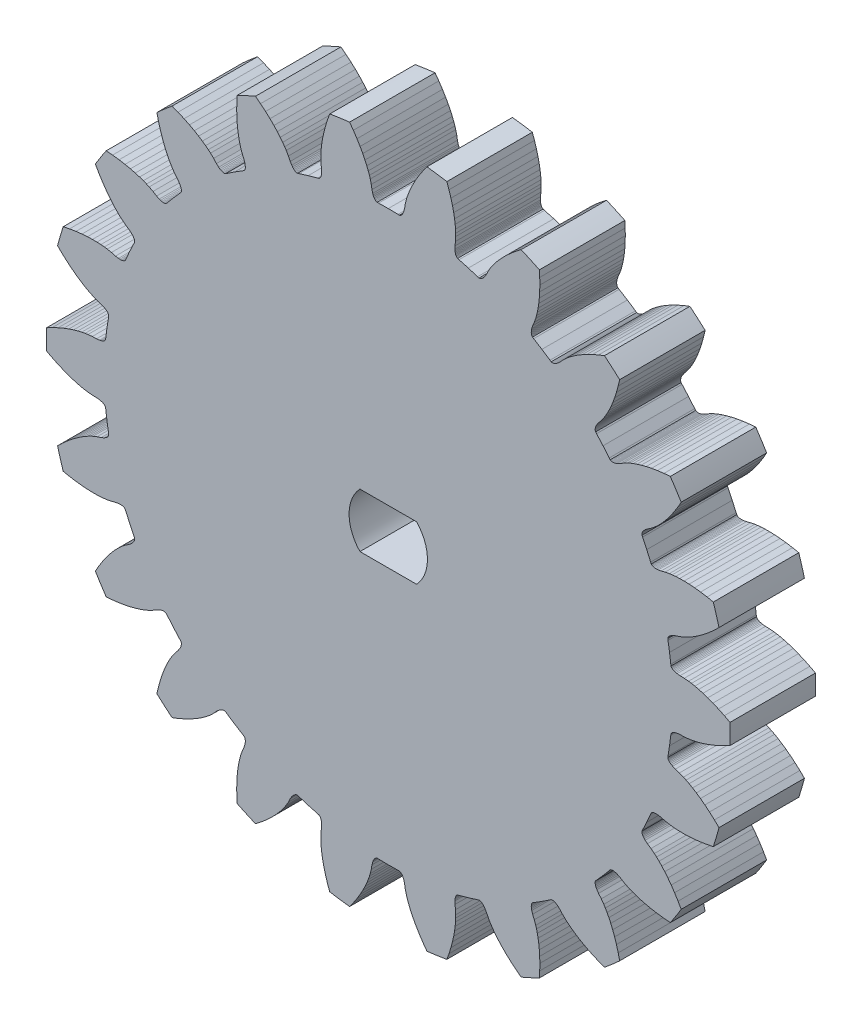
from build123d import *

# Parameters (mm, degrees)
BOSS_EXTRUDE1_DEPTH = 6


with BuildPart() as part:
    # Model → Boss-Extrude1 (new body)
    with BuildSketch(Plane.XY):
        with BuildLine():
            Line((22.5519537, 5.4619929), (22.8954461, 5.7695777))
            Line((22.8954461, 5.7695777), (23.216661298, 6.081558392))
            ThreePointArc((23.216661298, 6.081558392), (23.027805404, 6.761573866), (22.81903653, 7.435742355))
            Line((22.81903653, 7.435742355), (22.3801441, 7.5245351))
            Line((22.3801441, 7.5245351), (21.924887, 7.5975859))
            Line((21.924887, 7.5975859), (21.5060561, 7.646915))
            Line((21.5060561, 7.646915), (21.1197237, 7.6761155))
            Line((21.1197237, 7.6761155), (20.7695422, 7.6878778))
            Line((20.7695422, 7.6878778), (20.4552721, 7.6853026))
            Line((20.4552721, 7.6853026), (20.1767714, 7.6713482))
            Line((20.1767714, 7.6713482), (19.9347995, 7.6490219))
            Line((19.9347995, 7.6490219), (19.73335, 7.6219283))
            Line((19.73335, 7.6219283), (19.4360948, 7.5636803))
            Line((19.4360948, 7.5636803), (19.1488665, 7.4859797))
            Line((19.1488665, 7.4859797), (18.9443781, 7.4508803))
            Line((18.9443781, 7.4508803), (18.8538346, 7.4443357))
            Line((18.8538346, 7.4443357), (18.7714324, 7.4446863))
            Line((18.7714324, 7.4446863), (18.697414, 7.45157))
            Line((18.697414, 7.45157), (18.6320181, 7.4646561))
            Line((18.6320181, 7.4646561), (18.575464, 7.4835611))
            Line((18.575464, 7.4835611), (18.5279675, 7.5079327))
            Line((18.5279675, 7.5079327), (18.4897345, 7.5373924))
            Line((18.4897345, 7.5373924), (18.4609353, 7.5715671))
            Line((18.4609353, 7.5715671), (18.4188308, 7.6649666))
            Line((18.4188308, 7.6649666), (18.1471583, 8.2875295))
            Line((18.1471583, 8.2875295), (17.8545643, 8.9005379))
            Line((17.8545643, 8.9005379), (17.8115502, 8.993522))
            Line((17.8115502, 8.993522), (17.8045822, 9.0376666))
            Line((17.8045822, 9.0376666), (17.8073554, 9.0858532))
            Line((17.8073554, 9.0858532), (17.8200401, 9.1377087))
            Line((17.8200401, 9.1377087), (17.8427877, 9.1928296))
            Line((17.8427877, 9.1928296), (17.8757231, 9.2508221))
            Line((17.8757231, 9.2508221), (17.9189925, 9.3112693))
            Line((17.9189925, 9.3112693), (17.9726895, 9.3737743))
            Line((17.9726895, 9.3737743), (18.036929, 9.4379168))
            Line((18.036929, 9.4379168), (18.1973667, 9.5694736))
            Line((18.1973667, 9.5694736), (18.4441834, 9.7356631))
            Line((18.4441834, 9.7356631), (18.6828652, 9.9221693))
            Line((18.6828652, 9.9221693), (18.8352625, 10.0566722))
            Line((18.8352625, 10.0566722), (19.0105934, 10.2249217))
            Line((19.0105934, 10.2249217), (19.2035186, 10.4262603))
            Line((19.2035186, 10.4262603), (19.4112681, 10.6620834))
            Line((19.4112681, 10.6620834), (19.6316988, 10.9344355))
            Line((19.6316988, 10.9344355), (19.8626244, 11.2455283))
            Line((19.8626244, 11.2455283), (20.0996199, 11.5943634))
            Line((20.0996199, 11.5943634), (20.3425418, 11.9862618))
            Line((20.3425418, 11.9862618), (20.5628503, 12.3761017))
            ThreePointArc((20.5628503, 12.3761017), (20.190062091, 12.975365035), (19.7998148, 13.5634081))
            Line((19.7998148, 13.5634081), (19.3536845, 13.5249538))
            Line((19.3536845, 13.5249538), (18.8962878, 13.4667848))
            Line((18.8962878, 13.4667848), (18.4805248, 13.3961174))
            Line((18.4805248, 13.3961174), (18.1016148, 13.3152927))
            Line((18.1016148, 13.3152927), (17.7623043, 13.227921))
            Line((17.7623043, 13.227921), (17.4614899, 13.1369099))
            Line((17.4614899, 13.1369099), (17.1982018, 13.0450581))
            Line((17.1982018, 13.0450581), (16.9723216, 12.9554648))
            Line((16.9723216, 12.9554648), (16.7866653, 12.8727138))
            Line((16.7866653, 12.8727138), (16.5178614, 12.7330787))
            Line((16.5178614, 12.7330787), (16.2641587, 12.577604))
            Line((16.2641587, 12.577604), (16.0778422, 12.4863154))
            Line((16.0778422, 12.4863154), (15.9928101, 12.4545268))
            Line((15.9928101, 12.4545268), (15.913647, 12.4316478))
            Line((15.913647, 12.4316478), (15.8406875, 12.4173993))
            Line((15.8406875, 12.4173993), (15.7742538, 12.4115312))
            Line((15.7742538, 12.4115312), (15.7146644, 12.4137373))
            Line((15.7146644, 12.4137373), (15.6622255, 12.4237404))
            Line((15.6622255, 12.4237404), (15.6172415, 12.4412352))
            Line((15.6172415, 12.4412352), (15.5799807, 12.4659119))
            Line((15.5799807, 12.4659119), (15.5132681, 12.5436659))
            Line((15.5132681, 12.5436659), (15.077204, 13.0644716))
            Line((15.077204, 13.0644716), (14.6237577, 13.5702156))
            Line((14.6237577, 13.5702156), (14.5562893, 13.6473147))
            Line((14.5562893, 13.6473147), (14.5371666, 13.6877081))
            Line((14.5371666, 13.6877081), (14.5262517, 13.734724))
            Line((14.5262517, 13.734724), (14.5238132, 13.7880527))
            Line((14.5238132, 13.7880527), (14.5301101, 13.8473496))
            Line((14.5301101, 13.8473496), (14.5453729, 13.9122719))
            Line((14.5453729, 13.9122719), (14.5698597, 13.9824611))
            Line((14.5698597, 13.9824611), (14.6037719, 14.0575624))
            Line((14.6037719, 14.0575624), (14.6473382, 14.137205))
            Line((14.6473382, 14.137205), (14.7642133, 14.3086333))
            Line((14.7642133, 14.3086333), (14.9542111, 14.5376273))
            Line((14.9542111, 14.5376273), (15.1306797, 14.7838231))
            Line((15.1306797, 14.7838231), (15.23901, 14.955813))
            Line((15.23901, 14.955813), (15.3598375, 15.1666436))
            Line((15.3598375, 15.1666436), (15.4882242, 15.4141799))
            Line((15.4882242, 15.4141799), (15.6211193, 15.6989803))
            Line((15.6211193, 15.6989803), (15.7558906, 16.0224027))
            Line((15.7558906, 16.0224027), (15.8898171, 16.3859534))
            Line((15.8898171, 16.3859534), (16.0189345, 16.7874275))
            Line((16.0189345, 16.7874275), (16.1416057, 17.2318903))
            Line((16.1416057, 17.2318903), (16.243159651, 17.668007218))
            ThreePointArc((16.243159651, 17.668007218), (15.716639844, 18.137969452), (15.176529291, 18.592247119))
            Line((15.176529291, 18.592247119), (14.7593045, 18.4296611))
            Line((14.7593045, 18.4296611), (14.3368236, 18.2449848))
            Line((14.3368236, 18.2449848), (13.9578113, 18.060046))
            Line((13.9578113, 18.060046), (13.6170208, 17.875744))
            Line((13.6170208, 17.875744), (13.3160702, 17.6963167))
            Line((13.3160702, 17.6963167), (13.0530816, 17.5242429))
            Line((13.0530816, 17.5242429), (12.8263363, 17.3619349))
            Line((12.8263363, 17.3619349), (12.6348471, 17.212333))
            Line((12.6348471, 17.212333), (12.4800249, 17.0806286))
            Line((12.4800249, 17.0806286), (12.2614491, 16.8709189))
            Line((12.2614491, 16.8709189), (12.0618254, 16.6502657))
            Line((12.0618254, 16.6502657), (11.908775, 16.5101834))
            Line((11.908775, 16.5101834), (11.8361432, 16.4557263))
            Line((11.8361432, 16.4557263), (11.7666326, 16.4114712))
            Line((11.7666326, 16.4114712), (11.7006427, 16.3772447))
            Line((11.7006427, 16.3772447), (11.6385533, 16.3528978))
            Line((11.6385533, 16.3528978), (11.5807561, 16.3382262))
            Line((11.5807561, 16.3382262), (11.5276232, 16.3330504))
            Line((11.5276232, 16.3330504), (11.4795324, 16.3371631))
            Line((11.4795324, 16.3371631), (11.4368288, 16.3503427))
            Line((11.4368288, 16.3503427), (11.3509127, 16.4061519))
            Line((11.3509127, 16.4061519), (10.7857843, 16.783008))
            Line((10.7857843, 16.783008), (10.2082212, 17.1405152))
            Line((10.2082212, 17.1405152), (10.1217644, 17.1954832))
            Line((10.1217644, 17.1954832), (10.0920362, 17.2288528))
            Line((10.0920362, 17.2288528), (10.0683175, 17.2708892))
            Line((10.0683175, 17.2708892), (10.0509534, 17.3213708))
            Line((10.0509534, 17.3213708), (10.0402893, 17.3800397))
            Line((10.0402893, 17.3800397), (10.0366432, 17.4466323))
            Line((10.0366432, 17.4466323), (10.0403635, 17.520877))
            Line((10.0403635, 17.520877), (10.0517435, 17.6024903))
            Line((10.0517435, 17.6024903), (10.0711072, 17.6911809))
            Line((10.0711072, 17.6911809), (10.134951, 17.8885927))
            Line((10.134951, 17.8885927), (10.2527376, 18.1618394))
            Line((10.2527376, 18.1618394), (10.3526966, 18.4477795))
            Line((10.3526966, 18.4477795), (10.4081836, 18.6433227))
            Line((10.4081836, 18.6433227), (10.4647189, 18.8796543))
            Line((10.4647189, 18.8796543), (10.518166, 19.1533343))
            Line((10.518166, 19.1533343), (10.5654404, 19.4640391))
            Line((10.5654404, 19.4640391), (10.6036338, 19.8123302))
            Line((10.6036338, 19.8123302), (10.6297113, 20.198886))
            Line((10.6297113, 20.198886), (10.6404902, 20.6204741))
            Line((10.6404902, 20.6204741), (10.6329728, 21.0814935))
            Line((10.6329728, 21.0814935), (10.6075447, 21.5285554))
            ThreePointArc((10.6075447, 21.5285554), (9.969949089, 21.831143292), (9.3237321, 22.114853))
            Line((9.3237321, 22.114853), (8.9692134, 21.841307))
            Line((8.9692134, 21.841307), (8.6158753, 21.5450847))
            Line((8.6158753, 21.5450847), (8.3043189, 21.2608571))
            Line((8.3043189, 21.2608571), (8.0292567, 20.9880088))
            Line((8.0292567, 20.9880088), (7.7910473, 20.731062))
            Line((7.7910473, 20.731062), (7.5871903, 20.491866))
            Line((7.5871903, 20.491866), (7.4153572, 20.2722511))
            Line((7.4153572, 20.2722511), (7.2737725, 20.0747603))
            Line((7.2737725, 20.0747603), (7.162327, 19.9047724))
            Line((7.162327, 19.9047724), (7.0116872, 19.6419776))
            Line((7.0116872, 19.6419776), (6.8823148, 19.3740219))
            Line((6.8823148, 19.3740219), (6.7749298, 19.1964946))
            Line((6.7749298, 19.1964946), (6.7205824, 19.1237806))
            Line((6.7205824, 19.1237806), (6.6663555, 19.0617348))
            Line((6.6663555, 19.0617348), (6.6126814, 19.0103032))
            Line((6.6126814, 19.0103032), (6.5599664, 18.9694499))
            Line((6.5599664, 18.9694499), (6.5086439, 18.9390893))
            Line((6.5086439, 18.9390893), (6.4591214, 18.9191539))
            Line((6.4591214, 18.9191539), (6.41182, 18.9095513))
            Line((6.41182, 18.9095513), (6.367133, 18.9101659))
            Line((6.367133, 18.9101659), (6.2689738, 18.9395092))
            Line((6.2689738, 18.9395092), (5.6205645, 19.1418848))
            Line((5.6205645, 19.1418848), (4.9656753, 19.3221921))
            Line((4.9656753, 19.3221921), (4.8672344, 19.3505759))
            Line((4.8672344, 19.3505759), (4.829309, 19.3742184))
            Line((4.829309, 19.3742184), (4.7947081, 19.4078697))
            Line((4.7947081, 19.4078697), (4.7638251, 19.4514143))
            Line((4.7638251, 19.4514143), (4.737064, 19.5047023))
            Line((4.737064, 19.5047023), (4.7148043, 19.5675702))
            Line((4.7148043, 19.5675702), (4.6974568, 19.6398556))
            Line((4.6974568, 19.6398556), (4.6853827, 19.7213692))
            Line((4.6853827, 19.7213692), (4.6789749, 19.8119225))
            Line((4.6789749, 19.8119225), (4.6846154, 20.0193246))
            Line((4.6846154, 20.0193246), (4.7206482, 20.3146873))
            Line((4.7206482, 20.3146873), (4.7359996, 20.6172065))
            Line((4.7359996, 20.6172065), (4.7341481, 20.8204613))
            Line((4.7341481, 20.8204613), (4.721811, 21.0631476))
            Line((4.721811, 21.0631476), (4.6959885, 21.3407995))
            Line((4.6959885, 21.3407995), (4.6538123, 21.6522373))
            Line((4.6538123, 21.6522373), (4.5923337, 21.9971805))
            Line((4.5923337, 21.9971805), (4.5084496, 22.3754249))
            Line((4.5084496, 22.3754249), (4.4000167, 22.7829725))
            Line((4.4000167, 22.7829725), (4.2629196, 23.2231995))
            Line((4.2629196, 23.2231995), (4.112569617, 23.644988633))
            ThreePointArc((4.112569617, 23.644988633), (3.415552159, 23.755687923), (2.715581155, 23.8458448))
            Line((2.715581155, 23.8458448), (2.45249, 23.4835))
            Line((2.45249, 23.4835), (2.19692, 23.09973))
            Line((2.19692, 23.09973), (1.97806, 22.73924))
            Line((1.97806, 22.73924), (1.79101, 22.39995))
            Line((1.79101, 22.39995), (1.63484, 22.0863))
            Line((1.63484, 22.0863), (1.50663, 21.79936))
            Line((1.50663, 21.79936), (1.40363, 21.54023))
            Line((1.40363, 21.54023), (1.32342, 21.31085))
            Line((1.32342, 21.31085), (1.26438, 21.11635))
            Line((1.26438, 21.11635), (1.19388, 20.82176))
            Line((1.19388, 20.82176), (1.14524, 20.52821))
            Line((1.14524, 20.52821), (1.09222, 20.32762))
            Line((1.09222, 20.32762), (1.06056, 20.24254))
            Line((1.06056, 20.24254), (1.02601, 20.16773))
            Line((1.02601, 20.16773), (0.989, 20.10326))
            Line((0.989, 20.10326), (0.94993, 20.04921))
            Line((0.94993, 20.04921), (0.90924, 20.00562))
            Line((0.90924, 20.00562), (0.86734, 19.97254))
            Line((0.86734, 19.97254), (0.82466, 19.95))
            Line((0.82466, 19.95), (0.78161, 19.938))
            Line((0.78161, 19.938), (0.67916, 19.9385))
            Line((0.67916, 19.9385), (0, 19.95))
            Line((0, 19.95), (-0.67916, 19.9385))
            Line((-0.67916, 19.9385), (-0.78161, 19.938))
            Line((-0.78161, 19.938), (-0.82466, 19.95))
            Line((-0.82466, 19.95), (-0.86734, 19.97254))
            Line((-0.86734, 19.97254), (-0.90924, 20.00562))
            Line((-0.90924, 20.00562), (-0.94993, 20.04921))
            Line((-0.94993, 20.04921), (-0.989, 20.10326))
            Line((-0.989, 20.10326), (-1.02601, 20.16773))
            Line((-1.02601, 20.16773), (-1.06056, 20.24254))
            Line((-1.06056, 20.24254), (-1.09222, 20.32762))
            Line((-1.09222, 20.32762), (-1.14524, 20.52821))
            Line((-1.14524, 20.52821), (-1.19388, 20.82176))
            Line((-1.19388, 20.82176), (-1.26438, 21.11635))
            Line((-1.26438, 21.11635), (-1.32342, 21.31085))
            Line((-1.32342, 21.31085), (-1.40363, 21.54023))
            Line((-1.40363, 21.54023), (-1.50663, 21.79936))
            Line((-1.50663, 21.79936), (-1.63484, 22.0863))
            Line((-1.63484, 22.0863), (-1.79101, 22.39995))
            Line((-1.79101, 22.39995), (-1.97806, 22.73924))
            Line((-1.97806, 22.73924), (-2.19692, 23.09973))
            Line((-2.19692, 23.09973), (-2.45249, 23.4835))
            Line((-2.45249, 23.4835), (-2.7155813, 23.845845))
            ThreePointArc((-2.7155813, 23.845845), (-3.415552276, 23.755687905), (-4.1125697, 23.6449884))
            Line((-4.1125697, 23.6449884), (-4.2629196, 23.2231995))
            Line((-4.2629196, 23.2231995), (-4.4000167, 22.7829725))
            Line((-4.4000167, 22.7829725), (-4.5084496, 22.3754249))
            Line((-4.5084496, 22.3754249), (-4.5923337, 21.9971805))
            Line((-4.5923337, 21.9971805), (-4.6538123, 21.6522373))
            Line((-4.6538123, 21.6522373), (-4.6959885, 21.3407995))
            Line((-4.6959885, 21.3407995), (-4.721811, 21.0631476))
            Line((-4.721811, 21.0631476), (-4.7341481, 20.8204613))
            Line((-4.7341481, 20.8204613), (-4.7359996, 20.6172065))
            Line((-4.7359996, 20.6172065), (-4.7206482, 20.3146873))
            Line((-4.7206482, 20.3146873), (-4.6846154, 20.0193246))
            Line((-4.6846154, 20.0193246), (-4.6789749, 19.8119225))
            Line((-4.6789749, 19.8119225), (-4.6853827, 19.7213692))
            Line((-4.6853827, 19.7213692), (-4.6974568, 19.6398556))
            Line((-4.6974568, 19.6398556), (-4.7148043, 19.5675702))
            Line((-4.7148043, 19.5675702), (-4.737064, 19.5047023))
            Line((-4.737064, 19.5047023), (-4.7638251, 19.4514143))
            Line((-4.7638251, 19.4514143), (-4.7947081, 19.4078697))
            Line((-4.7947081, 19.4078697), (-4.829309, 19.3742184))
            Line((-4.829309, 19.3742184), (-4.8672344, 19.3505759))
            Line((-4.8672344, 19.3505759), (-4.9656753, 19.3221921))
            Line((-4.9656753, 19.3221921), (-5.6205645, 19.1418848))
            Line((-5.6205645, 19.1418848), (-6.2689738, 18.9395092))
            Line((-6.2689738, 18.9395092), (-6.367133, 18.9101659))
            Line((-6.367133, 18.9101659), (-6.41182, 18.9095513))
            Line((-6.41182, 18.9095513), (-6.4591214, 18.9191539))
            Line((-6.4591214, 18.9191539), (-6.5086439, 18.9390893))
            Line((-6.5086439, 18.9390893), (-6.5599664, 18.9694499))
            Line((-6.5599664, 18.9694499), (-6.6126814, 19.0103032))
            Line((-6.6126814, 19.0103032), (-6.6663555, 19.0617348))
            Line((-6.6663555, 19.0617348), (-6.7205824, 19.1237806))
            Line((-6.7205824, 19.1237806), (-6.7749298, 19.1964946))
            Line((-6.7749298, 19.1964946), (-6.8823148, 19.3740219))
            Line((-6.8823148, 19.3740219), (-7.0116872, 19.6419776))
            Line((-7.0116872, 19.6419776), (-7.162327, 19.9047724))
            Line((-7.162327, 19.9047724), (-7.2737725, 20.0747603))
            Line((-7.2737725, 20.0747603), (-7.4153572, 20.2722511))
            Line((-7.4153572, 20.2722511), (-7.5871903, 20.491866))
            Line((-7.5871903, 20.491866), (-7.7910473, 20.731062))
            Line((-7.7910473, 20.731062), (-8.0292567, 20.9880088))
            Line((-8.0292567, 20.9880088), (-8.3043189, 21.2608571))
            Line((-8.3043189, 21.2608571), (-8.6158753, 21.5450847))
            Line((-8.6158753, 21.5450847), (-8.9692134, 21.841307))
            Line((-8.9692134, 21.841307), (-9.323732277, 22.114853137))
            ThreePointArc((-9.323732277, 22.114853137), (-9.969949187, 21.831143248), (-10.607544713, 21.528555177))
            Line((-10.607544713, 21.528555177), (-10.6329728, 21.0814935))
            Line((-10.6329728, 21.0814935), (-10.6404902, 20.6204741))
            Line((-10.6404902, 20.6204741), (-10.6297113, 20.198886))
            Line((-10.6297113, 20.198886), (-10.6036338, 19.8123302))
            Line((-10.6036338, 19.8123302), (-10.5654404, 19.4640391))
            Line((-10.5654404, 19.4640391), (-10.518166, 19.1533343))
            Line((-10.518166, 19.1533343), (-10.4647189, 18.8796543))
            Line((-10.4647189, 18.8796543), (-10.4081836, 18.6433227))
            Line((-10.4081836, 18.6433227), (-10.3526966, 18.4477795))
            Line((-10.3526966, 18.4477795), (-10.2527376, 18.1618394))
            Line((-10.2527376, 18.1618394), (-10.134951, 17.8885927))
            Line((-10.134951, 17.8885927), (-10.0711072, 17.6911809))
            Line((-10.0711072, 17.6911809), (-10.0517435, 17.6024903))
            Line((-10.0517435, 17.6024903), (-10.0403635, 17.520877))
            Line((-10.0403635, 17.520877), (-10.0366432, 17.4466323))
            Line((-10.0366432, 17.4466323), (-10.0402893, 17.3800397))
            Line((-10.0402893, 17.3800397), (-10.0509534, 17.3213708))
            Line((-10.0509534, 17.3213708), (-10.0683175, 17.2708892))
            Line((-10.0683175, 17.2708892), (-10.0920362, 17.2288528))
            Line((-10.0920362, 17.2288528), (-10.1217644, 17.1954832))
            Line((-10.1217644, 17.1954832), (-10.2082212, 17.1405152))
            Line((-10.2082212, 17.1405152), (-10.7857843, 16.783008))
            Line((-10.7857843, 16.783008), (-11.3509127, 16.4061519))
            Line((-11.3509127, 16.4061519), (-11.4368288, 16.3503427))
            Line((-11.4368288, 16.3503427), (-11.4795324, 16.3371631))
            Line((-11.4795324, 16.3371631), (-11.5276232, 16.3330504))
            Line((-11.5276232, 16.3330504), (-11.5807561, 16.3382262))
            Line((-11.5807561, 16.3382262), (-11.6385533, 16.3528978))
            Line((-11.6385533, 16.3528978), (-11.7006427, 16.3772447))
            Line((-11.7006427, 16.3772447), (-11.7666326, 16.4114712))
            Line((-11.7666326, 16.4114712), (-11.8361432, 16.4557263))
            Line((-11.8361432, 16.4557263), (-11.908775, 16.5101834))
            Line((-11.908775, 16.5101834), (-12.0618254, 16.6502657))
            Line((-12.0618254, 16.6502657), (-12.2614491, 16.8709189))
            Line((-12.2614491, 16.8709189), (-12.4800249, 17.0806286))
            Line((-12.4800249, 17.0806286), (-12.6348471, 17.212333))
            Line((-12.6348471, 17.212333), (-12.8263363, 17.3619349))
            Line((-12.8263363, 17.3619349), (-13.0530816, 17.5242429))
            Line((-13.0530816, 17.5242429), (-13.3160702, 17.6963167))
            Line((-13.3160702, 17.6963167), (-13.6170208, 17.875744))
            Line((-13.6170208, 17.875744), (-13.9578113, 18.060046))
            Line((-13.9578113, 18.060046), (-14.3368236, 18.2449848))
            Line((-14.3368236, 18.2449848), (-14.7593045, 18.4296611))
            Line((-14.7593045, 18.4296611), (-15.1765295, 18.5922472))
            ThreePointArc((-15.1765295, 18.5922472), (-15.716639925, 18.137969381), (-16.2431596, 17.668007))
            Line((-16.2431596, 17.668007), (-16.1416057, 17.2318903))
            Line((-16.1416057, 17.2318903), (-16.0189345, 16.7874275))
            Line((-16.0189345, 16.7874275), (-15.8898171, 16.3859534))
            Line((-15.8898171, 16.3859534), (-15.7558906, 16.0224027))
            Line((-15.7558906, 16.0224027), (-15.6211193, 15.6989803))
            Line((-15.6211193, 15.6989803), (-15.4882242, 15.4141799))
            Line((-15.4882242, 15.4141799), (-15.3598375, 15.1666436))
            Line((-15.3598375, 15.1666436), (-15.23901, 14.955813))
            Line((-15.23901, 14.955813), (-15.1306797, 14.7838231))
            Line((-15.1306797, 14.7838231), (-14.9542111, 14.5376273))
            Line((-14.9542111, 14.5376273), (-14.7642133, 14.3086333))
            Line((-14.7642133, 14.3086333), (-14.6473382, 14.137205))
            Line((-14.6473382, 14.137205), (-14.6037719, 14.0575624))
            Line((-14.6037719, 14.0575624), (-14.5698597, 13.9824611))
            Line((-14.5698597, 13.9824611), (-14.5453729, 13.9122719))
            Line((-14.5453729, 13.9122719), (-14.5301101, 13.8473496))
            Line((-14.5301101, 13.8473496), (-14.5238132, 13.7880527))
            Line((-14.5238132, 13.7880527), (-14.5262517, 13.734724))
            Line((-14.5262517, 13.734724), (-14.5371666, 13.6877081))
            Line((-14.5371666, 13.6877081), (-14.5562893, 13.6473147))
            Line((-14.5562893, 13.6473147), (-14.6237577, 13.5702156))
            Line((-14.6237577, 13.5702156), (-15.077204, 13.0644716))
            Line((-15.077204, 13.0644716), (-15.5132681, 12.5436659))
            Line((-15.5132681, 12.5436659), (-15.5799807, 12.4659119))
            Line((-15.5799807, 12.4659119), (-15.6172415, 12.4412352))
            Line((-15.6172415, 12.4412352), (-15.6622255, 12.4237404))
            Line((-15.6622255, 12.4237404), (-15.7146644, 12.4137373))
            Line((-15.7146644, 12.4137373), (-15.7742538, 12.4115312))
            Line((-15.7742538, 12.4115312), (-15.8406875, 12.4173993))
            Line((-15.8406875, 12.4173993), (-15.913647, 12.4316478))
            Line((-15.913647, 12.4316478), (-15.9928101, 12.4545268))
            Line((-15.9928101, 12.4545268), (-16.0778422, 12.4863154))
            Line((-16.0778422, 12.4863154), (-16.2641587, 12.577604))
            Line((-16.2641587, 12.577604), (-16.5178614, 12.7330787))
            Line((-16.5178614, 12.7330787), (-16.7866653, 12.8727138))
            Line((-16.7866653, 12.8727138), (-16.9723216, 12.9554648))
            Line((-16.9723216, 12.9554648), (-17.1982018, 13.0450581))
            Line((-17.1982018, 13.0450581), (-17.4614899, 13.1369099))
            Line((-17.4614899, 13.1369099), (-17.7623043, 13.227921))
            Line((-17.7623043, 13.227921), (-18.1016148, 13.3152927))
            Line((-18.1016148, 13.3152927), (-18.4805248, 13.3961174))
            Line((-18.4805248, 13.3961174), (-18.8962878, 13.4667848))
            Line((-18.8962878, 13.4667848), (-19.3536845, 13.5249538))
            Line((-19.3536845, 13.5249538), (-19.799815075, 13.563408124))
            ThreePointArc((-19.799815075, 13.563408124), (-20.190062162, 12.975364924), (-20.562850164, 12.37610146))
            Line((-20.562850164, 12.37610146), (-20.3425418, 11.9862618))
            Line((-20.3425418, 11.9862618), (-20.0996199, 11.5943634))
            Line((-20.0996199, 11.5943634), (-19.8626244, 11.2455283))
            Line((-19.8626244, 11.2455283), (-19.6316988, 10.9344355))
            Line((-19.6316988, 10.9344355), (-19.4112681, 10.6620834))
            Line((-19.4112681, 10.6620834), (-19.2035186, 10.4262603))
            Line((-19.2035186, 10.4262603), (-19.0105934, 10.2249217))
            Line((-19.0105934, 10.2249217), (-18.8352625, 10.0566722))
            Line((-18.8352625, 10.0566722), (-18.6828652, 9.9221693))
            Line((-18.6828652, 9.9221693), (-18.4441834, 9.7356631))
            Line((-18.4441834, 9.7356631), (-18.1973667, 9.5694736))
            Line((-18.1973667, 9.5694736), (-18.036929, 9.4379168))
            Line((-18.036929, 9.4379168), (-17.9726895, 9.3737743))
            Line((-17.9726895, 9.3737743), (-17.9189925, 9.3112693))
            Line((-17.9189925, 9.3112693), (-17.8757231, 9.2508221))
            Line((-17.8757231, 9.2508221), (-17.8427877, 9.1928296))
            Line((-17.8427877, 9.1928296), (-17.8200401, 9.1377087))
            Line((-17.8200401, 9.1377087), (-17.8073554, 9.0858532))
            Line((-17.8073554, 9.0858532), (-17.8045822, 9.0376666))
            Line((-17.8045822, 9.0376666), (-17.8115502, 8.993522))
            Line((-17.8115502, 8.993522), (-17.8545643, 8.9005379))
            Line((-17.8545643, 8.9005379), (-18.1471583, 8.2875295))
            Line((-18.1471583, 8.2875295), (-18.4188308, 7.6649666))
            Line((-18.4188308, 7.6649666), (-18.4609353, 7.5715671))
            Line((-18.4609353, 7.5715671), (-18.4897345, 7.5373924))
            Line((-18.4897345, 7.5373924), (-18.5279675, 7.5079327))
            Line((-18.5279675, 7.5079327), (-18.575464, 7.4835611))
            Line((-18.575464, 7.4835611), (-18.6320181, 7.4646561))
            Line((-18.6320181, 7.4646561), (-18.697414, 7.45157))
            Line((-18.697414, 7.45157), (-18.7714324, 7.4446863))
            Line((-18.7714324, 7.4446863), (-18.8538346, 7.4443357))
            Line((-18.8538346, 7.4443357), (-18.9443781, 7.4508803))
            Line((-18.9443781, 7.4508803), (-19.1488665, 7.4859797))
            Line((-19.1488665, 7.4859797), (-19.4360948, 7.5636803))
            Line((-19.4360948, 7.5636803), (-19.73335, 7.6219283))
            Line((-19.73335, 7.6219283), (-19.9347995, 7.6490219))
            Line((-19.9347995, 7.6490219), (-20.1767714, 7.6713482))
            Line((-20.1767714, 7.6713482), (-20.4552721, 7.6853026))
            Line((-20.4552721, 7.6853026), (-20.7695422, 7.6878778))
            Line((-20.7695422, 7.6878778), (-21.1197237, 7.6761155))
            Line((-21.1197237, 7.6761155), (-21.5060561, 7.646915))
            Line((-21.5060561, 7.646915), (-21.924887, 7.5975859))
            Line((-21.924887, 7.5975859), (-22.3801441, 7.5245351))
            Line((-22.3801441, 7.5245351), (-22.8190368, 7.4357423))
            ThreePointArc((-22.8190368, 7.4357423), (-23.027805441, 6.761573739), (-23.2166611, 6.0815582))
            Line((-23.2166611, 6.0815582), (-22.8954461, 5.7695777))
            Line((-22.8954461, 5.7695777), (-22.5519537, 5.4619929))
            Line((-22.5519537, 5.4619929), (-22.22628, 5.1940575))
            Line((-22.22628, 5.1940575), (-21.9170635, 4.9606254))
            Line((-21.9170635, 4.9606254), (-21.6288313, 4.7614079))
            Line((-21.6288313, 4.7614079), (-21.3630581, 4.5936671))
            Line((-21.3630581, 4.5936671), (-21.1212241, 4.4548374))
            Line((-21.1212241, 4.4548374), (-20.905594, 4.3427997))
            Line((-20.905594, 4.3427997), (-20.721476, 4.2566804))
            Line((-20.721476, 4.2566804), (-20.4399177, 4.1449734))
            Line((-20.4399177, 4.1449734), (-20.1562778, 4.055052))
            Line((-20.1562778, 4.055052), (-19.965275, 3.9740247))
            Line((-19.965275, 3.9740247), (-19.8855667, 3.9305788))
            Line((-19.8855667, 3.9305788), (-19.8164351, 3.8857339))
            Line((-19.8164351, 3.8857339), (-19.7578884, 3.8399256))
            Line((-19.7578884, 3.8399256), (-19.7099488, 3.7935612))
            Line((-19.7099488, 3.7935612), (-19.6725933, 3.7470818))
            Line((-19.6725933, 3.7470818), (-19.645813, 3.7009005))
            Line((-19.645813, 3.7009005), (-19.6295764, 3.6554472))
            Line((-19.6295764, 3.6554472), (-19.6238252, 3.6111276))
            Line((-19.6238252, 3.6111276), (-19.6389003, 3.5097915))
            Line((-19.6389003, 3.5097915), (-19.7469378, 2.839181))
            Line((-19.7469378, 2.839181), (-19.8322094, 2.1652973))
            Line((-19.8322094, 2.1652973), (-19.8462946, 2.0638189))
            Line((-19.8462946, 2.0638189), (-19.8642991, 2.0229149))
            Line((-19.8642991, 2.0229149), (-19.8926837, 1.9838771))
            Line((-19.8926837, 1.9838771), (-19.93139, 1.9471113))
            Line((-19.93139, 1.9471113), (-19.9803271, 1.913039))
            Line((-19.9803271, 1.913039), (-20.0393872, 1.8820588))
            Line((-20.0393872, 1.8820588), (-20.108468, 1.8546005))
            Line((-20.108468, 1.8546005), (-20.1874336, 1.8310488))
            Line((-20.1874336, 1.8310488), (-20.2761533, 1.8118192))
            Line((-20.2761533, 1.8118192), (-20.4822471, 1.7878858))
            Line((-20.4822471, 1.7878858), (-20.7797313, 1.7815174))
            Line((-20.7797313, 1.7815174), (-21.081356, 1.7536595))
            Line((-21.081356, 1.7536595), (-21.2822786, 1.7229007))
            Line((-21.2822786, 1.7229007), (-21.5207389, 1.6761513))
            Line((-21.5207389, 1.6761513), (-21.7918898, 1.6110777))
            Line((-21.7918898, 1.6110777), (-22.0941553, 1.5250085))
            Line((-22.0941553, 1.5250085), (-22.4268381, 1.4150652))
            Line((-22.4268381, 1.4150652), (-22.7892946, 1.2782051))
            Line((-22.7892946, 1.2782051), (-23.1772624, 1.1128758))
            Line((-23.1772624, 1.1128758), (-23.5934975, 0.9145233))
            Line((-23.5934975, 0.9145233), (-23.989596415, 0.705676787))
            ThreePointArc((-23.989596415, 0.705676787), (-23.999973025, -1.16e-07), (-23.989595985, -0.705677013))
            Line((-23.989595985, -0.705677013), (-23.5934975, -0.9145233))
            Line((-23.5934975, -0.9145233), (-23.1772624, -1.1128758))
            Line((-23.1772624, -1.1128758), (-22.7892946, -1.2782051))
            Line((-22.7892946, -1.2782051), (-22.4268381, -1.4150652))
            Line((-22.4268381, -1.4150652), (-22.0941553, -1.5250085))
            Line((-22.0941553, -1.5250085), (-21.7918898, -1.6110777))
            Line((-21.7918898, -1.6110777), (-21.5207389, -1.6761513))
            Line((-21.5207389, -1.6761513), (-21.2822786, -1.7229007))
            Line((-21.2822786, -1.7229007), (-21.081356, -1.7536595))
            Line((-21.081356, -1.7536595), (-20.7797313, -1.7815174))
            Line((-20.7797313, -1.7815174), (-20.4822471, -1.7878858))
            Line((-20.4822471, -1.7878858), (-20.2761533, -1.8118192))
            Line((-20.2761533, -1.8118192), (-20.1874336, -1.8310488))
            Line((-20.1874336, -1.8310488), (-20.108468, -1.8546005))
            Line((-20.108468, -1.8546005), (-20.0393872, -1.8820588))
            Line((-20.0393872, -1.8820588), (-19.9803271, -1.913039))
            Line((-19.9803271, -1.913039), (-19.93139, -1.9471113))
            Line((-19.93139, -1.9471113), (-19.8926837, -1.9838771))
            Line((-19.8926837, -1.9838771), (-19.8642991, -2.0229149))
            Line((-19.8642991, -2.0229149), (-19.8462946, -2.0638189))
            Line((-19.8462946, -2.0638189), (-19.8322094, -2.1652973))
            Line((-19.8322094, -2.1652973), (-19.7469378, -2.839181))
            Line((-19.7469378, -2.839181), (-19.6389003, -3.5097915))
            Line((-19.6389003, -3.5097915), (-19.6238252, -3.6111276))
            Line((-19.6238252, -3.6111276), (-19.6295764, -3.6554472))
            Line((-19.6295764, -3.6554472), (-19.645813, -3.7009005))
            Line((-19.645813, -3.7009005), (-19.6725933, -3.7470818))
            Line((-19.6725933, -3.7470818), (-19.7099488, -3.7935612))
            Line((-19.7099488, -3.7935612), (-19.7578884, -3.8399256))
            Line((-19.7578884, -3.8399256), (-19.8164351, -3.8857339))
            Line((-19.8164351, -3.8857339), (-19.8855667, -3.9305788))
            Line((-19.8855667, -3.9305788), (-19.965275, -3.9740247))
            Line((-19.965275, -3.9740247), (-20.1562778, -4.055052))
            Line((-20.1562778, -4.055052), (-20.4399177, -4.1449734))
            Line((-20.4399177, -4.1449734), (-20.721476, -4.2566804))
            Line((-20.721476, -4.2566804), (-20.905594, -4.3427997))
            Line((-20.905594, -4.3427997), (-21.1212241, -4.4548374))
            Line((-21.1212241, -4.4548374), (-21.3630581, -4.5936671))
            Line((-21.3630581, -4.5936671), (-21.6288313, -4.7614079))
            Line((-21.6288313, -4.7614079), (-21.9170635, -4.9606254))
            Line((-21.9170635, -4.9606254), (-22.22628, -5.1940575))
            Line((-22.22628, -5.1940575), (-22.5519537, -5.4619929))
            Line((-22.5519537, -5.4619929), (-22.8954461, -5.7695777))
            Line((-22.8954461, -5.7695777), (-23.2166611, -6.0815582))
            ThreePointArc((-23.2166611, -6.0815582), (-23.027805441, -6.761573739), (-22.8190368, -7.4357423))
            Line((-22.8190368, -7.4357423), (-22.3801441, -7.5245351))
            Line((-22.3801441, -7.5245351), (-21.924887, -7.5975859))
            Line((-21.924887, -7.5975859), (-21.5060561, -7.646915))
            Line((-21.5060561, -7.646915), (-21.1197237, -7.6761155))
            Line((-21.1197237, -7.6761155), (-20.7695422, -7.6878778))
            Line((-20.7695422, -7.6878778), (-20.4552721, -7.6853026))
            Line((-20.4552721, -7.6853026), (-20.1767714, -7.6713482))
            Line((-20.1767714, -7.6713482), (-19.9347995, -7.6490219))
            Line((-19.9347995, -7.6490219), (-19.73335, -7.6219283))
            Line((-19.73335, -7.6219283), (-19.4360948, -7.5636803))
            Line((-19.4360948, -7.5636803), (-19.1488665, -7.4859797))
            Line((-19.1488665, -7.4859797), (-18.9443781, -7.4508803))
            Line((-18.9443781, -7.4508803), (-18.8538346, -7.4443357))
            Line((-18.8538346, -7.4443357), (-18.7714324, -7.4446863))
            Line((-18.7714324, -7.4446863), (-18.697414, -7.45157))
            Line((-18.697414, -7.45157), (-18.6320181, -7.4646561))
            Line((-18.6320181, -7.4646561), (-18.575464, -7.4835611))
            Line((-18.575464, -7.4835611), (-18.5279675, -7.5079327))
            Line((-18.5279675, -7.5079327), (-18.4897345, -7.5373924))
            Line((-18.4897345, -7.5373924), (-18.4609353, -7.5715671))
            Line((-18.4609353, -7.5715671), (-18.4188308, -7.6649666))
            Line((-18.4188308, -7.6649666), (-18.1471583, -8.2875295))
            Line((-18.1471583, -8.2875295), (-17.8545643, -8.9005379))
            Line((-17.8545643, -8.9005379), (-17.8115502, -8.993522))
            Line((-17.8115502, -8.993522), (-17.8045822, -9.0376666))
            Line((-17.8045822, -9.0376666), (-17.8073554, -9.0858532))
            Line((-17.8073554, -9.0858532), (-17.8200401, -9.1377087))
            Line((-17.8200401, -9.1377087), (-17.8427877, -9.1928296))
            Line((-17.8427877, -9.1928296), (-17.8757231, -9.2508221))
            Line((-17.8757231, -9.2508221), (-17.9189925, -9.3112693))
            Line((-17.9189925, -9.3112693), (-17.9726895, -9.3737743))
            Line((-17.9726895, -9.3737743), (-18.036929, -9.4379168))
            Line((-18.036929, -9.4379168), (-18.1973667, -9.5694736))
            Line((-18.1973667, -9.5694736), (-18.4441834, -9.7356631))
            Line((-18.4441834, -9.7356631), (-18.6828652, -9.9221693))
            Line((-18.6828652, -9.9221693), (-18.8352625, -10.0566722))
            Line((-18.8352625, -10.0566722), (-19.0105934, -10.2249217))
            Line((-19.0105934, -10.2249217), (-19.2035186, -10.4262603))
            Line((-19.2035186, -10.4262603), (-19.4112681, -10.6620834))
            Line((-19.4112681, -10.6620834), (-19.6316988, -10.9344355))
            Line((-19.6316988, -10.9344355), (-19.8626244, -11.2455283))
            Line((-19.8626244, -11.2455283), (-20.0996199, -11.5943634))
            Line((-20.0996199, -11.5943634), (-20.3425418, -11.9862618))
            Line((-20.3425418, -11.9862618), (-20.562850433, -12.376101935))
            ThreePointArc((-20.562850433, -12.376101935), (-20.190062021, -12.975365144), (-19.799814531, -13.563408077))
            Line((-19.799814531, -13.563408077), (-19.3536845, -13.5249538))
            Line((-19.3536845, -13.5249538), (-18.8962878, -13.4667848))
            Line((-18.8962878, -13.4667848), (-18.4805248, -13.3961174))
            Line((-18.4805248, -13.3961174), (-18.1016148, -13.3152927))
            Line((-18.1016148, -13.3152927), (-17.7623043, -13.227921))
            Line((-17.7623043, -13.227921), (-17.4614899, -13.1369099))
            Line((-17.4614899, -13.1369099), (-17.1982018, -13.0450581))
            Line((-17.1982018, -13.0450581), (-16.9723216, -12.9554648))
            Line((-16.9723216, -12.9554648), (-16.7866653, -12.8727138))
            Line((-16.7866653, -12.8727138), (-16.5178614, -12.7330787))
            Line((-16.5178614, -12.7330787), (-16.2641587, -12.577604))
            Line((-16.2641587, -12.577604), (-16.0778422, -12.4863154))
            Line((-16.0778422, -12.4863154), (-15.9928101, -12.4545268))
            Line((-15.9928101, -12.4545268), (-15.913647, -12.4316478))
            Line((-15.913647, -12.4316478), (-15.8406875, -12.4173993))
            Line((-15.8406875, -12.4173993), (-15.7742538, -12.4115312))
            Line((-15.7742538, -12.4115312), (-15.7146644, -12.4137373))
            Line((-15.7146644, -12.4137373), (-15.6622255, -12.4237404))
            Line((-15.6622255, -12.4237404), (-15.6172415, -12.4412352))
            Line((-15.6172415, -12.4412352), (-15.5799807, -12.4659119))
            Line((-15.5799807, -12.4659119), (-15.5132681, -12.5436659))
            Line((-15.5132681, -12.5436659), (-15.077204, -13.0644716))
            Line((-15.077204, -13.0644716), (-14.6237577, -13.5702156))
            Line((-14.6237577, -13.5702156), (-14.5562893, -13.6473147))
            Line((-14.5562893, -13.6473147), (-14.5371666, -13.6877081))
            Line((-14.5371666, -13.6877081), (-14.5262517, -13.734724))
            Line((-14.5262517, -13.734724), (-14.5238132, -13.7880527))
            Line((-14.5238132, -13.7880527), (-14.5301101, -13.8473496))
            Line((-14.5301101, -13.8473496), (-14.5453729, -13.9122719))
            Line((-14.5453729, -13.9122719), (-14.5698597, -13.9824611))
            Line((-14.5698597, -13.9824611), (-14.6037719, -14.0575624))
            Line((-14.6037719, -14.0575624), (-14.6473382, -14.137205))
            Line((-14.6473382, -14.137205), (-14.7642133, -14.3086333))
            Line((-14.7642133, -14.3086333), (-14.9542111, -14.5376273))
            Line((-14.9542111, -14.5376273), (-15.1306797, -14.7838231))
            Line((-15.1306797, -14.7838231), (-15.23901, -14.955813))
            Line((-15.23901, -14.955813), (-15.3598375, -15.1666436))
            Line((-15.3598375, -15.1666436), (-15.4882242, -15.4141799))
            Line((-15.4882242, -15.4141799), (-15.6211193, -15.6989803))
            Line((-15.6211193, -15.6989803), (-15.7558906, -16.0224027))
            Line((-15.7558906, -16.0224027), (-15.8898171, -16.3859534))
            Line((-15.8898171, -16.3859534), (-16.0189345, -16.7874275))
            Line((-16.0189345, -16.7874275), (-16.1416057, -17.2318903))
            Line((-16.1416057, -17.2318903), (-16.2431596, -17.668007))
            ThreePointArc((-16.2431596, -17.668007), (-15.716639925, -18.137969381), (-15.1765295, -18.5922472))
            Line((-15.1765295, -18.5922472), (-14.7593045, -18.4296611))
            Line((-14.7593045, -18.4296611), (-14.3368236, -18.2449848))
            Line((-14.3368236, -18.2449848), (-13.9578113, -18.060046))
            Line((-13.9578113, -18.060046), (-13.6170208, -17.875744))
            Line((-13.6170208, -17.875744), (-13.3160702, -17.6963167))
            Line((-13.3160702, -17.6963167), (-13.0530816, -17.5242429))
            Line((-13.0530816, -17.5242429), (-12.8263363, -17.3619349))
            Line((-12.8263363, -17.3619349), (-12.6348471, -17.212333))
            Line((-12.6348471, -17.212333), (-12.4800249, -17.0806286))
            Line((-12.4800249, -17.0806286), (-12.2614491, -16.8709189))
            Line((-12.2614491, -16.8709189), (-12.0618254, -16.6502657))
            Line((-12.0618254, -16.6502657), (-11.908775, -16.5101834))
            Line((-11.908775, -16.5101834), (-11.8361432, -16.4557263))
            Line((-11.8361432, -16.4557263), (-11.7666326, -16.4114712))
            Line((-11.7666326, -16.4114712), (-11.7006427, -16.3772447))
            Line((-11.7006427, -16.3772447), (-11.6385533, -16.3528978))
            Line((-11.6385533, -16.3528978), (-11.5807561, -16.3382262))
            Line((-11.5807561, -16.3382262), (-11.5276232, -16.3330504))
            Line((-11.5276232, -16.3330504), (-11.4795324, -16.3371631))
            Line((-11.4795324, -16.3371631), (-11.4368288, -16.3503427))
            Line((-11.4368288, -16.3503427), (-11.3509127, -16.4061519))
            Line((-11.3509127, -16.4061519), (-10.7857843, -16.783008))
            Line((-10.7857843, -16.783008), (-10.2082212, -17.1405152))
            Line((-10.2082212, -17.1405152), (-10.1217644, -17.1954832))
            Line((-10.1217644, -17.1954832), (-10.0920362, -17.2288528))
            Line((-10.0920362, -17.2288528), (-10.0683175, -17.2708892))
            Line((-10.0683175, -17.2708892), (-10.0509534, -17.3213708))
            Line((-10.0509534, -17.3213708), (-10.0402893, -17.3800397))
            Line((-10.0402893, -17.3800397), (-10.0366432, -17.4466323))
            Line((-10.0366432, -17.4466323), (-10.0403635, -17.520877))
            Line((-10.0403635, -17.520877), (-10.0517435, -17.6024903))
            Line((-10.0517435, -17.6024903), (-10.0711072, -17.6911809))
            Line((-10.0711072, -17.6911809), (-10.134951, -17.8885927))
            Line((-10.134951, -17.8885927), (-10.2527376, -18.1618394))
            Line((-10.2527376, -18.1618394), (-10.3526966, -18.4477795))
            Line((-10.3526966, -18.4477795), (-10.4081836, -18.6433227))
            Line((-10.4081836, -18.6433227), (-10.4647189, -18.8796543))
            Line((-10.4647189, -18.8796543), (-10.518166, -19.1533343))
            Line((-10.518166, -19.1533343), (-10.5654404, -19.4640391))
            Line((-10.5654404, -19.4640391), (-10.6036338, -19.8123302))
            Line((-10.6036338, -19.8123302), (-10.6297113, -20.198886))
            Line((-10.6297113, -20.198886), (-10.6404902, -20.6204741))
            Line((-10.6404902, -20.6204741), (-10.6329728, -21.0814935))
            Line((-10.6329728, -21.0814935), (-10.607544684, -21.528555677))
            ThreePointArc((-10.607544684, -21.528555677), (-9.969948968, -21.831143348), (-9.323731881, -22.114852831))
            Line((-9.323731881, -22.114852831), (-8.9692134, -21.841307))
            Line((-8.9692134, -21.841307), (-8.6158753, -21.5450847))
            Line((-8.6158753, -21.5450847), (-8.3043189, -21.2608571))
            Line((-8.3043189, -21.2608571), (-8.0292567, -20.9880088))
            Line((-8.0292567, -20.9880088), (-7.7910473, -20.731062))
            Line((-7.7910473, -20.731062), (-7.5871903, -20.491866))
            Line((-7.5871903, -20.491866), (-7.4153572, -20.2722511))
            Line((-7.4153572, -20.2722511), (-7.2737725, -20.0747603))
            Line((-7.2737725, -20.0747603), (-7.162327, -19.9047724))
            Line((-7.162327, -19.9047724), (-7.0116872, -19.6419776))
            Line((-7.0116872, -19.6419776), (-6.8823148, -19.3740219))
            Line((-6.8823148, -19.3740219), (-6.7749298, -19.1964946))
            Line((-6.7749298, -19.1964946), (-6.7205824, -19.1237806))
            Line((-6.7205824, -19.1237806), (-6.6663555, -19.0617348))
            Line((-6.6663555, -19.0617348), (-6.6126814, -19.0103032))
            Line((-6.6126814, -19.0103032), (-6.5599664, -18.9694499))
            Line((-6.5599664, -18.9694499), (-6.5086439, -18.9390893))
            Line((-6.5086439, -18.9390893), (-6.4591214, -18.9191539))
            Line((-6.4591214, -18.9191539), (-6.41182, -18.9095513))
            Line((-6.41182, -18.9095513), (-6.367133, -18.9101659))
            Line((-6.367133, -18.9101659), (-6.2689738, -18.9395092))
            Line((-6.2689738, -18.9395092), (-5.6205645, -19.1418848))
            Line((-5.6205645, -19.1418848), (-4.9656753, -19.3221921))
            Line((-4.9656753, -19.3221921), (-4.8672344, -19.3505759))
            Line((-4.8672344, -19.3505759), (-4.829309, -19.3742184))
            Line((-4.829309, -19.3742184), (-4.7947081, -19.4078697))
            Line((-4.7947081, -19.4078697), (-4.7638251, -19.4514143))
            Line((-4.7638251, -19.4514143), (-4.737064, -19.5047023))
            Line((-4.737064, -19.5047023), (-4.7148043, -19.5675702))
            Line((-4.7148043, -19.5675702), (-4.6974568, -19.6398556))
            Line((-4.6974568, -19.6398556), (-4.6853827, -19.7213692))
            Line((-4.6853827, -19.7213692), (-4.6789749, -19.8119225))
            Line((-4.6789749, -19.8119225), (-4.6846154, -20.0193246))
            Line((-4.6846154, -20.0193246), (-4.7206482, -20.3146873))
            Line((-4.7206482, -20.3146873), (-4.7359996, -20.6172065))
            Line((-4.7359996, -20.6172065), (-4.7341481, -20.8204613))
            Line((-4.7341481, -20.8204613), (-4.721811, -21.0631476))
            Line((-4.721811, -21.0631476), (-4.6959885, -21.3407995))
            Line((-4.6959885, -21.3407995), (-4.6538123, -21.6522373))
            Line((-4.6538123, -21.6522373), (-4.5923337, -21.9971805))
            Line((-4.5923337, -21.9971805), (-4.5084496, -22.3754249))
            Line((-4.5084496, -22.3754249), (-4.4000167, -22.7829725))
            Line((-4.4000167, -22.7829725), (-4.2629196, -23.2231995))
            Line((-4.2629196, -23.2231995), (-4.1125697, -23.6449884))
            ThreePointArc((-4.1125697, -23.6449884), (-3.415552276, -23.755687905), (-2.7155813, -23.845845))
            Line((-2.7155813, -23.845845), (-2.45249, -23.4835))
            Line((-2.45249, -23.4835), (-2.19692, -23.09973))
            Line((-2.19692, -23.09973), (-1.97806, -22.73924))
            Line((-1.97806, -22.73924), (-1.79101, -22.39995))
            Line((-1.79101, -22.39995), (-1.63484, -22.0863))
            Line((-1.63484, -22.0863), (-1.50663, -21.79936))
            Line((-1.50663, -21.79936), (-1.40363, -21.54023))
            Line((-1.40363, -21.54023), (-1.32342, -21.31085))
            Line((-1.32342, -21.31085), (-1.26438, -21.11635))
            Line((-1.26438, -21.11635), (-1.19388, -20.82176))
            Line((-1.19388, -20.82176), (-1.14524, -20.52821))
            Line((-1.14524, -20.52821), (-1.09222, -20.32762))
            Line((-1.09222, -20.32762), (-1.06056, -20.24254))
            Line((-1.06056, -20.24254), (-1.02601, -20.16773))
            Line((-1.02601, -20.16773), (-0.989, -20.10326))
            Line((-0.989, -20.10326), (-0.94993, -20.04921))
            Line((-0.94993, -20.04921), (-0.90924, -20.00562))
            Line((-0.90924, -20.00562), (-0.86734, -19.97254))
            Line((-0.86734, -19.97254), (-0.82466, -19.95))
            Line((-0.82466, -19.95), (-0.78161, -19.938))
            Line((-0.78161, -19.938), (-0.67916, -19.9385))
            Line((-0.67916, -19.9385), (0, -19.95))
            Line((0, -19.95), (0.67916, -19.9385))
            Line((0.67916, -19.9385), (0.78161, -19.938))
            Line((0.78161, -19.938), (0.82466, -19.95))
            Line((0.82466, -19.95), (0.86734, -19.97254))
            Line((0.86734, -19.97254), (0.90924, -20.00562))
            Line((0.90924, -20.00562), (0.94993, -20.04921))
            Line((0.94993, -20.04921), (0.989, -20.10326))
            Line((0.989, -20.10326), (1.02601, -20.16773))
            Line((1.02601, -20.16773), (1.06056, -20.24254))
            Line((1.06056, -20.24254), (1.09222, -20.32762))
            Line((1.09222, -20.32762), (1.14524, -20.52821))
            Line((1.14524, -20.52821), (1.19388, -20.82176))
            Line((1.19388, -20.82176), (1.26438, -21.11635))
            Line((1.26438, -21.11635), (1.32342, -21.31085))
            Line((1.32342, -21.31085), (1.40363, -21.54023))
            Line((1.40363, -21.54023), (1.50663, -21.79936))
            Line((1.50663, -21.79936), (1.63484, -22.0863))
            Line((1.63484, -22.0863), (1.79101, -22.39995))
            Line((1.79101, -22.39995), (1.97806, -22.73924))
            Line((1.97806, -22.73924), (2.19692, -23.09973))
            Line((2.19692, -23.09973), (2.45249, -23.4835))
            Line((2.45249, -23.4835), (2.715581463, -23.845845224))
            ThreePointArc((2.715581463, -23.845845224), (3.415552408, -23.755687887), (4.112569793, -23.644988139))
            Line((4.112569793, -23.644988139), (4.2629196, -23.2231995))
            Line((4.2629196, -23.2231995), (4.4000167, -22.7829725))
            Line((4.4000167, -22.7829725), (4.5084496, -22.3754249))
            Line((4.5084496, -22.3754249), (4.5923337, -21.9971805))
            Line((4.5923337, -21.9971805), (4.6538123, -21.6522373))
            Line((4.6538123, -21.6522373), (4.6959885, -21.3407995))
            Line((4.6959885, -21.3407995), (4.721811, -21.0631476))
            Line((4.721811, -21.0631476), (4.7341481, -20.8204613))
            Line((4.7341481, -20.8204613), (4.7359996, -20.6172065))
            Line((4.7359996, -20.6172065), (4.7206482, -20.3146873))
            Line((4.7206482, -20.3146873), (4.6846154, -20.0193246))
            Line((4.6846154, -20.0193246), (4.6789749, -19.8119225))
            Line((4.6789749, -19.8119225), (4.6853827, -19.7213692))
            Line((4.6853827, -19.7213692), (4.6974568, -19.6398556))
            Line((4.6974568, -19.6398556), (4.7148043, -19.5675702))
            Line((4.7148043, -19.5675702), (4.737064, -19.5047023))
            Line((4.737064, -19.5047023), (4.7638251, -19.4514143))
            Line((4.7638251, -19.4514143), (4.7947081, -19.4078697))
            Line((4.7947081, -19.4078697), (4.829309, -19.3742184))
            Line((4.829309, -19.3742184), (4.8672344, -19.3505759))
            Line((4.8672344, -19.3505759), (4.9656753, -19.3221921))
            Line((4.9656753, -19.3221921), (5.6205645, -19.1418848))
            Line((5.6205645, -19.1418848), (6.2689738, -18.9395092))
            Line((6.2689738, -18.9395092), (6.367133, -18.9101659))
            Line((6.367133, -18.9101659), (6.41182, -18.9095513))
            Line((6.41182, -18.9095513), (6.4591214, -18.9191539))
            Line((6.4591214, -18.9191539), (6.5086439, -18.9390893))
            Line((6.5086439, -18.9390893), (6.5599664, -18.9694499))
            Line((6.5599664, -18.9694499), (6.6126814, -19.0103032))
            Line((6.6126814, -19.0103032), (6.6663555, -19.0617348))
            Line((6.6663555, -19.0617348), (6.7205824, -19.1237806))
            Line((6.7205824, -19.1237806), (6.7749298, -19.1964946))
            Line((6.7749298, -19.1964946), (6.8823148, -19.3740219))
            Line((6.8823148, -19.3740219), (7.0116872, -19.6419776))
            Line((7.0116872, -19.6419776), (7.162327, -19.9047724))
            Line((7.162327, -19.9047724), (7.2737725, -20.0747603))
            Line((7.2737725, -20.0747603), (7.4153572, -20.2722511))
            Line((7.4153572, -20.2722511), (7.5871903, -20.491866))
            Line((7.5871903, -20.491866), (7.7910473, -20.731062))
            Line((7.7910473, -20.731062), (8.0292567, -20.9880088))
            Line((8.0292567, -20.9880088), (8.3043189, -21.2608571))
            Line((8.3043189, -21.2608571), (8.6158753, -21.5450847))
            Line((8.6158753, -21.5450847), (8.9692134, -21.841307))
            Line((8.9692134, -21.841307), (9.3237321, -22.114853))
            ThreePointArc((9.3237321, -22.114853), (9.969949089, -21.831143292), (10.6075447, -21.5285554))
            Line((10.6075447, -21.5285554), (10.6329728, -21.0814935))
            Line((10.6329728, -21.0814935), (10.6404902, -20.6204741))
            Line((10.6404902, -20.6204741), (10.6297113, -20.198886))
            Line((10.6297113, -20.198886), (10.6036338, -19.8123302))
            Line((10.6036338, -19.8123302), (10.5654404, -19.4640391))
            Line((10.5654404, -19.4640391), (10.518166, -19.1533343))
            Line((10.518166, -19.1533343), (10.4647189, -18.8796543))
            Line((10.4647189, -18.8796543), (10.4081836, -18.6433227))
            Line((10.4081836, -18.6433227), (10.3526966, -18.4477795))
            Line((10.3526966, -18.4477795), (10.2527376, -18.1618394))
            Line((10.2527376, -18.1618394), (10.134951, -17.8885927))
            Line((10.134951, -17.8885927), (10.0711072, -17.6911809))
            Line((10.0711072, -17.6911809), (10.0517435, -17.6024903))
            Line((10.0517435, -17.6024903), (10.0403635, -17.520877))
            Line((10.0403635, -17.520877), (10.0366432, -17.4466323))
            Line((10.0366432, -17.4466323), (10.0402893, -17.3800397))
            Line((10.0402893, -17.3800397), (10.0509534, -17.3213708))
            Line((10.0509534, -17.3213708), (10.0683175, -17.2708892))
            Line((10.0683175, -17.2708892), (10.0920362, -17.2288528))
            Line((10.0920362, -17.2288528), (10.1217644, -17.1954832))
            Line((10.1217644, -17.1954832), (10.2082212, -17.1405152))
            Line((10.2082212, -17.1405152), (10.7857843, -16.783008))
            Line((10.7857843, -16.783008), (11.3509127, -16.4061519))
            Line((11.3509127, -16.4061519), (11.4368288, -16.3503427))
            Line((11.4368288, -16.3503427), (11.4795324, -16.3371631))
            Line((11.4795324, -16.3371631), (11.5276232, -16.3330504))
            Line((11.5276232, -16.3330504), (11.5807561, -16.3382262))
            Line((11.5807561, -16.3382262), (11.6385533, -16.3528978))
            Line((11.6385533, -16.3528978), (11.7006427, -16.3772447))
            Line((11.7006427, -16.3772447), (11.7666326, -16.4114712))
            Line((11.7666326, -16.4114712), (11.8361432, -16.4557263))
            Line((11.8361432, -16.4557263), (11.908775, -16.5101834))
            Line((11.908775, -16.5101834), (12.0618254, -16.6502657))
            Line((12.0618254, -16.6502657), (12.2614491, -16.8709189))
            Line((12.2614491, -16.8709189), (12.4800249, -17.0806286))
            Line((12.4800249, -17.0806286), (12.6348471, -17.212333))
            Line((12.6348471, -17.212333), (12.8263363, -17.3619349))
            Line((12.8263363, -17.3619349), (13.0530816, -17.5242429))
            Line((13.0530816, -17.5242429), (13.3160702, -17.6963167))
            Line((13.3160702, -17.6963167), (13.6170208, -17.875744))
            Line((13.6170208, -17.875744), (13.9578113, -18.060046))
            Line((13.9578113, -18.060046), (14.3368236, -18.2449848))
            Line((14.3368236, -18.2449848), (14.7593045, -18.4296611))
            Line((14.7593045, -18.4296611), (15.176529753, -18.592247298))
            ThreePointArc((15.176529753, -18.592247298), (15.716640024, -18.137969297), (16.243159539, -17.668006736))
            Line((16.243159539, -17.668006736), (16.1416057, -17.2318903))
            Line((16.1416057, -17.2318903), (16.0189345, -16.7874275))
            Line((16.0189345, -16.7874275), (15.8898171, -16.3859534))
            Line((15.8898171, -16.3859534), (15.7558906, -16.0224027))
            Line((15.7558906, -16.0224027), (15.6211193, -15.6989803))
            Line((15.6211193, -15.6989803), (15.4882242, -15.4141799))
            Line((15.4882242, -15.4141799), (15.3598375, -15.1666436))
            Line((15.3598375, -15.1666436), (15.23901, -14.955813))
            Line((15.23901, -14.955813), (15.1306797, -14.7838231))
            Line((15.1306797, -14.7838231), (14.9542111, -14.5376273))
            Line((14.9542111, -14.5376273), (14.7642133, -14.3086333))
            Line((14.7642133, -14.3086333), (14.6473382, -14.137205))
            Line((14.6473382, -14.137205), (14.6037719, -14.0575624))
            Line((14.6037719, -14.0575624), (14.5698597, -13.9824611))
            Line((14.5698597, -13.9824611), (14.5453729, -13.9122719))
            Line((14.5453729, -13.9122719), (14.5301101, -13.8473496))
            Line((14.5301101, -13.8473496), (14.5238132, -13.7880527))
            Line((14.5238132, -13.7880527), (14.5262517, -13.734724))
            Line((14.5262517, -13.734724), (14.5371666, -13.6877081))
            Line((14.5371666, -13.6877081), (14.5562893, -13.6473147))
            Line((14.5562893, -13.6473147), (14.6237577, -13.5702156))
            Line((14.6237577, -13.5702156), (15.077204, -13.0644716))
            Line((15.077204, -13.0644716), (15.5132681, -12.5436659))
            Line((15.5132681, -12.5436659), (15.5799807, -12.4659119))
            Line((15.5799807, -12.4659119), (15.6172415, -12.4412352))
            Line((15.6172415, -12.4412352), (15.6622255, -12.4237404))
            Line((15.6622255, -12.4237404), (15.7146644, -12.4137373))
            Line((15.7146644, -12.4137373), (15.7742538, -12.4115312))
            Line((15.7742538, -12.4115312), (15.8406875, -12.4173993))
            Line((15.8406875, -12.4173993), (15.913647, -12.4316478))
            Line((15.913647, -12.4316478), (15.9928101, -12.4545268))
            Line((15.9928101, -12.4545268), (16.0778422, -12.4863154))
            Line((16.0778422, -12.4863154), (16.2641587, -12.577604))
            Line((16.2641587, -12.577604), (16.5178614, -12.7330787))
            Line((16.5178614, -12.7330787), (16.7866653, -12.8727138))
            Line((16.7866653, -12.8727138), (16.9723216, -12.9554648))
            Line((16.9723216, -12.9554648), (17.1982018, -13.0450581))
            Line((17.1982018, -13.0450581), (17.4614899, -13.1369099))
            Line((17.4614899, -13.1369099), (17.7623043, -13.227921))
            Line((17.7623043, -13.227921), (18.1016148, -13.3152927))
            Line((18.1016148, -13.3152927), (18.4805248, -13.3961174))
            Line((18.4805248, -13.3961174), (18.8962878, -13.4667848))
            Line((18.8962878, -13.4667848), (19.3536845, -13.5249538))
            Line((19.3536845, -13.5249538), (19.7998148, -13.5634081))
            ThreePointArc((19.7998148, -13.5634081), (20.190062091, -12.975365035), (20.5628503, -12.3761017))
            Line((20.5628503, -12.3761017), (20.3425418, -11.9862618))
            Line((20.3425418, -11.9862618), (20.0996199, -11.5943634))
            Line((20.0996199, -11.5943634), (19.8626244, -11.2455283))
            Line((19.8626244, -11.2455283), (19.6316988, -10.9344355))
            Line((19.6316988, -10.9344355), (19.4112681, -10.6620834))
            Line((19.4112681, -10.6620834), (19.2035186, -10.4262603))
            Line((19.2035186, -10.4262603), (19.0105934, -10.2249217))
            Line((19.0105934, -10.2249217), (18.8352625, -10.0566722))
            Line((18.8352625, -10.0566722), (18.6828652, -9.9221693))
            Line((18.6828652, -9.9221693), (18.4441834, -9.7356631))
            Line((18.4441834, -9.7356631), (18.1973667, -9.5694736))
            Line((18.1973667, -9.5694736), (18.036929, -9.4379168))
            Line((18.036929, -9.4379168), (17.9726895, -9.3737743))
            Line((17.9726895, -9.3737743), (17.9189925, -9.3112693))
            Line((17.9189925, -9.3112693), (17.8757231, -9.2508221))
            Line((17.8757231, -9.2508221), (17.8427877, -9.1928296))
            Line((17.8427877, -9.1928296), (17.8200401, -9.1377087))
            Line((17.8200401, -9.1377087), (17.8073554, -9.0858532))
            Line((17.8073554, -9.0858532), (17.8045822, -9.0376666))
            Line((17.8045822, -9.0376666), (17.8115502, -8.993522))
            Line((17.8115502, -8.993522), (17.8545643, -8.9005379))
            Line((17.8545643, -8.9005379), (18.1471583, -8.2875295))
            Line((18.1471583, -8.2875295), (18.4188308, -7.6649666))
            Line((18.4188308, -7.6649666), (18.4609353, -7.5715671))
            Line((18.4609353, -7.5715671), (18.4897345, -7.5373924))
            Line((18.4897345, -7.5373924), (18.5279675, -7.5079327))
            Line((18.5279675, -7.5079327), (18.575464, -7.4835611))
            Line((18.575464, -7.4835611), (18.6320181, -7.4646561))
            Line((18.6320181, -7.4646561), (18.697414, -7.45157))
            Line((18.697414, -7.45157), (18.7714324, -7.4446863))
            Line((18.7714324, -7.4446863), (18.8538346, -7.4443357))
            Line((18.8538346, -7.4443357), (18.9443781, -7.4508803))
            Line((18.9443781, -7.4508803), (19.1488665, -7.4859797))
            Line((19.1488665, -7.4859797), (19.4360948, -7.5636803))
            Line((19.4360948, -7.5636803), (19.73335, -7.6219283))
            Line((19.73335, -7.6219283), (19.9347995, -7.6490219))
            Line((19.9347995, -7.6490219), (20.1767714, -7.6713482))
            Line((20.1767714, -7.6713482), (20.4552721, -7.6853026))
            Line((20.4552721, -7.6853026), (20.7695422, -7.6878778))
            Line((20.7695422, -7.6878778), (21.1197237, -7.6761155))
            Line((21.1197237, -7.6761155), (21.5060561, -7.646915))
            Line((21.5060561, -7.646915), (21.924887, -7.5975859))
            Line((21.924887, -7.5975859), (22.3801441, -7.5245351))
            Line((22.3801441, -7.5245351), (22.819037037, -7.435742252))
            ThreePointArc((22.819037037, -7.435742252), (23.027805474, -6.761573628), (23.216660927, -6.081558032))
            Line((23.216660927, -6.081558032), (22.8954461, -5.7695777))
            Line((22.8954461, -5.7695777), (22.5519537, -5.4619929))
            Line((22.5519537, -5.4619929), (22.22628, -5.1940575))
            Line((22.22628, -5.1940575), (21.9170635, -4.9606254))
            Line((21.9170635, -4.9606254), (21.6288313, -4.7614079))
            Line((21.6288313, -4.7614079), (21.3630581, -4.5936671))
            Line((21.3630581, -4.5936671), (21.1212241, -4.4548374))
            Line((21.1212241, -4.4548374), (20.905594, -4.3427997))
            Line((20.905594, -4.3427997), (20.721476, -4.2566804))
            Line((20.721476, -4.2566804), (20.4399177, -4.1449734))
            Line((20.4399177, -4.1449734), (20.1562778, -4.055052))
            Line((20.1562778, -4.055052), (19.965275, -3.9740247))
            Line((19.965275, -3.9740247), (19.8855667, -3.9305788))
            Line((19.8855667, -3.9305788), (19.8164351, -3.8857339))
            Line((19.8164351, -3.8857339), (19.7578884, -3.8399256))
            Line((19.7578884, -3.8399256), (19.7099488, -3.7935612))
            Line((19.7099488, -3.7935612), (19.6725933, -3.7470818))
            Line((19.6725933, -3.7470818), (19.645813, -3.7009005))
            Line((19.645813, -3.7009005), (19.6295764, -3.6554472))
            Line((19.6295764, -3.6554472), (19.6238252, -3.6111276))
            Line((19.6238252, -3.6111276), (19.6389003, -3.5097915))
            Line((19.6389003, -3.5097915), (19.7469378, -2.839181))
            Line((19.7469378, -2.839181), (19.8322094, -2.1652973))
            Line((19.8322094, -2.1652973), (19.8462946, -2.0638189))
            Line((19.8462946, -2.0638189), (19.8642991, -2.0229149))
            Line((19.8642991, -2.0229149), (19.8926837, -1.9838771))
            Line((19.8926837, -1.9838771), (19.93139, -1.9471113))
            Line((19.93139, -1.9471113), (19.9803271, -1.913039))
            Line((19.9803271, -1.913039), (20.0393872, -1.8820588))
            Line((20.0393872, -1.8820588), (20.108468, -1.8546005))
            Line((20.108468, -1.8546005), (20.1874336, -1.8310488))
            Line((20.1874336, -1.8310488), (20.2761533, -1.8118192))
            Line((20.2761533, -1.8118192), (20.4822471, -1.7878858))
            Line((20.4822471, -1.7878858), (20.7797313, -1.7815174))
            Line((20.7797313, -1.7815174), (21.081356, -1.7536595))
            Line((21.081356, -1.7536595), (21.2822786, -1.7229007))
            Line((21.2822786, -1.7229007), (21.5207389, -1.6761513))
            Line((21.5207389, -1.6761513), (21.7918898, -1.6110777))
            Line((21.7918898, -1.6110777), (22.0941553, -1.5250085))
            Line((22.0941553, -1.5250085), (22.4268381, -1.4150652))
            Line((22.4268381, -1.4150652), (22.7892946, -1.2782051))
            Line((22.7892946, -1.2782051), (23.1772624, -1.1128758))
            Line((23.1772624, -1.1128758), (23.5934975, -0.9145233))
            Line((23.5934975, -0.9145233), (23.9895962, -0.7056769))
            ThreePointArc((23.9895962, -0.7056769), (23.999973024, 0), (23.9895962, 0.7056769))
            Line((23.9895962, 0.7056769), (23.5934975, 0.9145233))
            Line((23.5934975, 0.9145233), (23.1772624, 1.1128758))
            Line((23.1772624, 1.1128758), (22.7892946, 1.2782051))
            Line((22.7892946, 1.2782051), (22.4268381, 1.4150652))
            Line((22.4268381, 1.4150652), (22.0941553, 1.5250085))
            Line((22.0941553, 1.5250085), (21.7918898, 1.6110777))
            Line((21.7918898, 1.6110777), (21.5207389, 1.6761513))
            Line((21.5207389, 1.6761513), (21.2822786, 1.7229007))
            Line((21.2822786, 1.7229007), (21.081356, 1.7536595))
            Line((21.081356, 1.7536595), (20.7797313, 1.7815174))
            Line((20.7797313, 1.7815174), (20.4822471, 1.7878858))
            Line((20.4822471, 1.7878858), (20.2761533, 1.8118192))
            Line((20.2761533, 1.8118192), (20.1874336, 1.8310488))
            Line((20.1874336, 1.8310488), (20.108468, 1.8546005))
            Line((20.108468, 1.8546005), (20.0393872, 1.8820588))
            Line((20.0393872, 1.8820588), (19.9803271, 1.913039))
            Line((19.9803271, 1.913039), (19.93139, 1.9471113))
            Line((19.93139, 1.9471113), (19.8926837, 1.9838771))
            Line((19.8926837, 1.9838771), (19.8642991, 2.0229149))
            Line((19.8642991, 2.0229149), (19.8462946, 2.0638189))
            Line((19.8462946, 2.0638189), (19.8322094, 2.1652973))
            Line((19.8322094, 2.1652973), (19.7469378, 2.839181))
            Line((19.7469378, 2.839181), (19.6389003, 3.5097915))
            Line((19.6389003, 3.5097915), (19.6238252, 3.6111276))
            Line((19.6238252, 3.6111276), (19.6295764, 3.6554472))
            Line((19.6295764, 3.6554472), (19.645813, 3.7009005))
            Line((19.645813, 3.7009005), (19.6725933, 3.7470818))
            Line((19.6725933, 3.7470818), (19.7099488, 3.7935612))
            Line((19.7099488, 3.7935612), (19.7578884, 3.8399256))
            Line((19.7578884, 3.8399256), (19.8164351, 3.8857339))
            Line((19.8164351, 3.8857339), (19.8855667, 3.9305788))
            Line((19.8855667, 3.9305788), (19.965275, 3.9740247))
            Line((19.965275, 3.9740247), (20.1562778, 4.055052))
            Line((20.1562778, 4.055052), (20.4399177, 4.1449734))
            Line((20.4399177, 4.1449734), (20.721476, 4.2566804))
            Line((20.721476, 4.2566804), (20.905594, 4.3427997))
            Line((20.905594, 4.3427997), (21.1212241, 4.4548374))
            Line((21.1212241, 4.4548374), (21.3630581, 4.5936671))
            Line((21.3630581, 4.5936671), (21.6288313, 4.7614079))
            Line((21.6288313, 4.7614079), (21.9170635, 4.9606254))
            Line((21.9170635, 4.9606254), (22.22628, 5.1940575))
            Line((22.22628, 5.1940575), (22.5519537, 5.4619929))
        make_face()
        with BuildLine():
            ThreePointArc((-1.988072262, -1.900020764), (-2.749982727, -2.0764e-05), (-1.988072262, 1.899979236))
            Line((-1.988072262, 1.899979236), (1.988106809, 1.899979236))
            ThreePointArc((1.988106809, 1.899979236), (2.750017273, -2.0764e-05), (1.988106809, -1.900020764))
            Line((1.988106809, -1.900020764), (-1.988072262, -1.900020764))
        make_face(mode=Mode.SUBTRACT)
    extrude(amount=BOSS_EXTRUDE1_DEPTH)


solid = part.part
